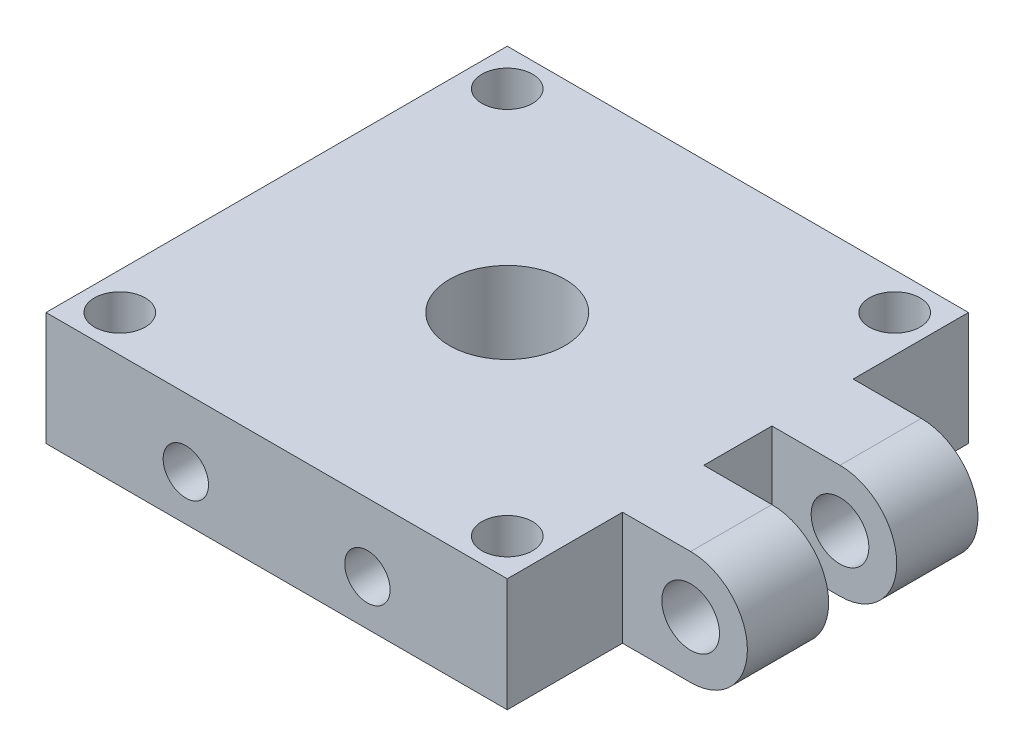
from build123d import *

# Parameters (mm, degrees)
SKETCH1_W           = 50.8
SKETCH1_H           = 50.8
SKETCH1_R           = 2.794
SKETCH1_R_2         = 6.35
BOSS_EXTRUDE1_DEPTH = 12.5
SKETCH4_R           = 3.175
BOSS_EXTRUDE2_DEPTH = 12.7
SKETCH5_W           = 13.75
SKETCH5_H           = 7.5
CUT_EXTRUDE2_DEPTH  = 49.312860607
SKETCH14_R          = 2.5
CUT_EXTRUDE7_DEPTH  = 20
SKETCH15_R          = 2.5
CUT_EXTRUDE8_DEPTH  = 20


with BuildPart() as part:
    # Sketch1 → Boss-Extrude1 (new body)
    with BuildSketch(Plane(origin=(0, 0, 0), x_dir=(1, 0, 0), z_dir=(0, 1, 0))):
        Rectangle(SKETCH1_W, SKETCH1_H)
        with Locations((-21.336, -21.336)):
            Circle(SKETCH1_R, mode=Mode.SUBTRACT)
        with Locations((21.336, -21.336)):
            Circle(SKETCH1_R, mode=Mode.SUBTRACT)
        with Locations((21.336, 21.336)):
            Circle(SKETCH1_R, mode=Mode.SUBTRACT)
        with Locations((-21.336, 21.336)):
            Circle(SKETCH1_R, mode=Mode.SUBTRACT)
        Circle(SKETCH1_R_2, mode=Mode.SUBTRACT)
    extrude(amount=BOSS_EXTRUDE1_DEPTH)

    # Sketch4 → Boss-Extrude2 (add, symmetric)
    with BuildSketch(Plane.XY):
        with BuildLine():
            Line((25.4, 0), (32.9, 0))
            ThreePointArc((32.9, 0), (39.15, 6.25), (32.9, 12.5))
            Line((32.9, 12.5), (25.4, 12.5))
            Line((25.4, 12.5), (25.4, 0))
        make_face()
        with Locations((32.9, 6.25)):
            Circle(SKETCH4_R, mode=Mode.SUBTRACT)
    extrude(amount=BOSS_EXTRUDE2_DEPTH, both=True)

    # Sketch5 → Cut-Extrude2 (cut, through all)
    with BuildSketch(Plane(origin=(0, 12.5, 0), x_dir=(1, 0, 0), z_dir=(0, 1, 0))):
        with Locations((32.275, 0)):
            Rectangle(SKETCH5_W, SKETCH5_H)
    extrude(amount=-CUT_EXTRUDE2_DEPTH, mode=Mode.SUBTRACT)

    # Sketch14 → Cut-Extrude7 (cut)
    with BuildSketch(Plane.XY.offset(25.4)):
        with Locations((-10, 5)):
            Circle(SKETCH14_R)
        with Locations((10, 5)):
            Circle(SKETCH14_R)
    extrude(amount=-CUT_EXTRUDE7_DEPTH, mode=Mode.SUBTRACT)

    # Sketch15 → Cut-Extrude8 (cut)
    with BuildSketch(Plane.ZY.offset(25.4)):
        with Locations((-10, 5)):
            Circle(SKETCH15_R)
        with Locations((10, 5)):
            Circle(SKETCH15_R)
    extrude(amount=-CUT_EXTRUDE8_DEPTH, mode=Mode.SUBTRACT)


solid = part.part
